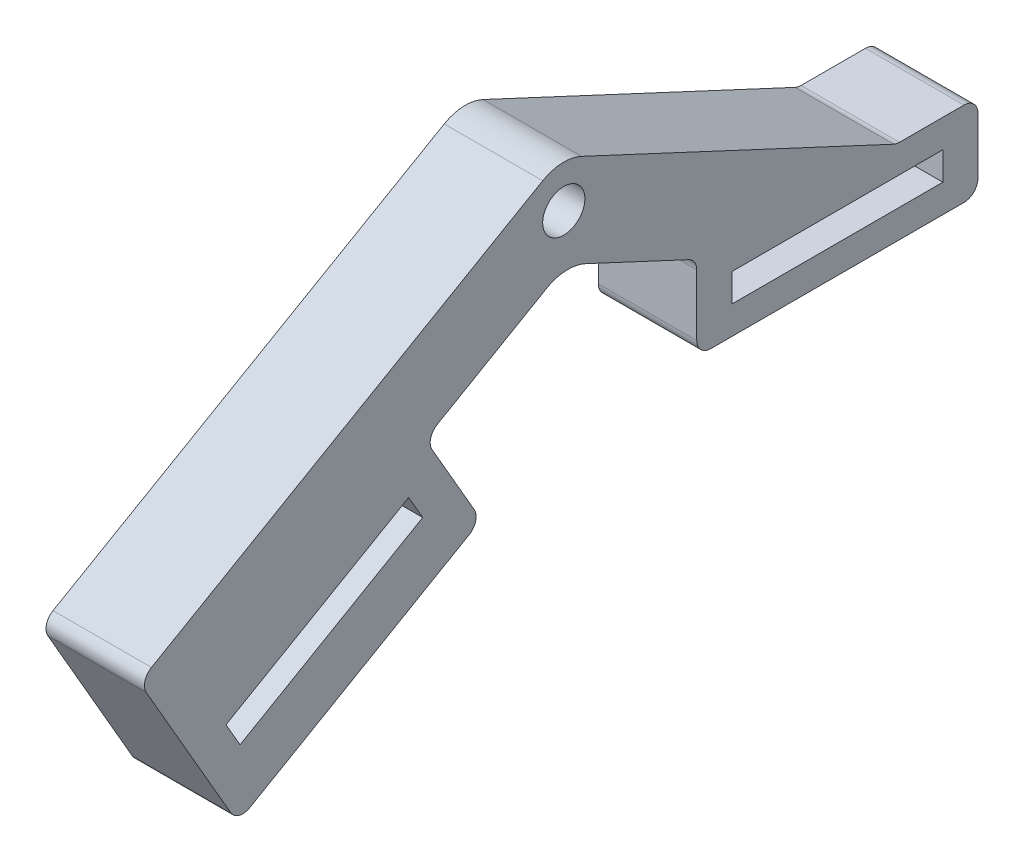
from build123d import *

# Parameters (mm, degrees)
CROQUIS1_R              = 1.5
CROQUIS1_W              = 15
CROQUIS1_H              = 2
SALIENTE_EXTRUIR1_DEPTH = 3.5
REDONDEO1_R             = 1


with BuildPart() as part:
    # Croquis1 → Saliente-Extruir1 (new, symmetric)
    with BuildSketch(Plane(origin=(0, 0, 0), x_dir=(0, 0, -1), z_dir=(1, 0, 0))):
        with BuildLine():
            Line((4.197209499, 3), (-18.186825032, 13.437846722))
            ThreePointArc((-18.186825032, 13.437846722), (-19.585537979, 13.716068026), (-20.954679817, 13.316999572))
            Line((-20.954679817, 13.316999572), (-49.640387672, -3.244701579))
            Line((-49.640387672, -3.244701579), (-42.640387672, -15.369057232))
            Line((-42.640387672, -15.369057232), (-25.319879596, -5.369057232))
            Line((-25.319879596, -5.369057232), (-29.319879596, 1.559145998))
            Line((-29.319879596, 1.559145998), (-20.659625558, 6.559145998))
            ThreePointArc((-20.659625558, 6.559145998), (-19.29048372, 6.958214451), (-17.891770773, 6.679993148))
            Line((-17.891770773, 6.679993148), (-10, 3))
            Line((-10, 3), (-10, -3))
            Line((-10, -3), (10, -3))
            Line((10, -3), (10, 3))
            Line((10, 3), (4.197209499, 3))
        make_face()
        with Locations((-19.454679817, 10.718923361)):
            Circle(CROQUIS1_R, mode=Mode.SUBTRACT)
        Rectangle(CROQUIS1_W, CROQUIS1_H, mode=Mode.SUBTRACT)
        Polygon((-30.484943106, -1.422904809), (-43.475324162, -8.922904809), (-42.475324162, -10.654955617), (-29.484943106, -3.154955617), align=None, mode=Mode.SUBTRACT)
    extrude(amount=SALIENTE_EXTRUIR1_DEPTH, both=True)

    # Redondeo1
    redondeo1_edges = [part.edges().sort_by_distance(p)[0] for p in [
        (0, 3, -10),
        (0, -3, -10),
        (0, -3, 10),
        (0, 3, 10),
        (0, 1.559145998, 29.319879596),
        (0, -5.369057232, 25.319879596),
        (0, -15.369057232, 42.640387672),
        (0, -3.244701579, 49.640387672),
        (0, 3, -4.197209499),
    ]]
    fillet(redondeo1_edges, radius=REDONDEO1_R)


solid = part.part
